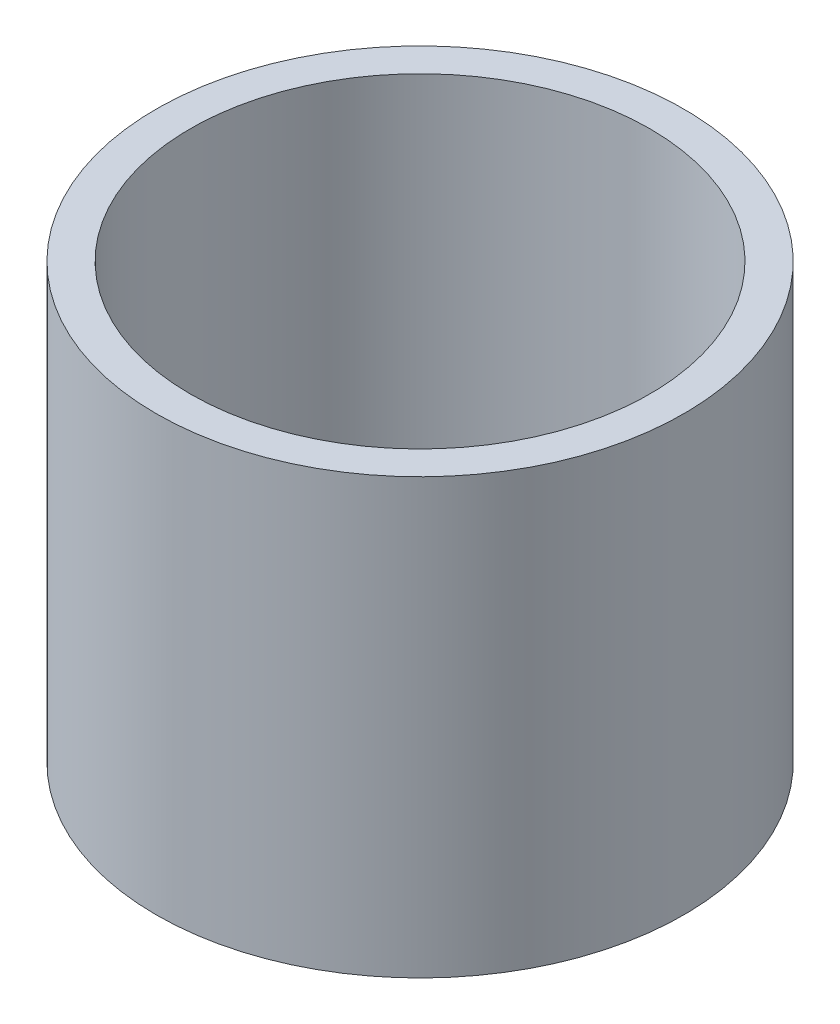
from build123d import *

# Parameters (mm, degrees)
SKETCH1_R           = 155
SKETCH1_R_2         = 135
BOSS_EXTRUDE1_DEPTH = 255


with BuildPart() as part:
    # Sketch1 → Boss-Extrude1 (new body)
    with BuildSketch(Plane(origin=(0, 0, 0), x_dir=(1, 0, 0), z_dir=(0, 1, 0))):
        Circle(SKETCH1_R)
        Circle(SKETCH1_R_2, mode=Mode.SUBTRACT)
    extrude(amount=BOSS_EXTRUDE1_DEPTH)


solid = part.part
